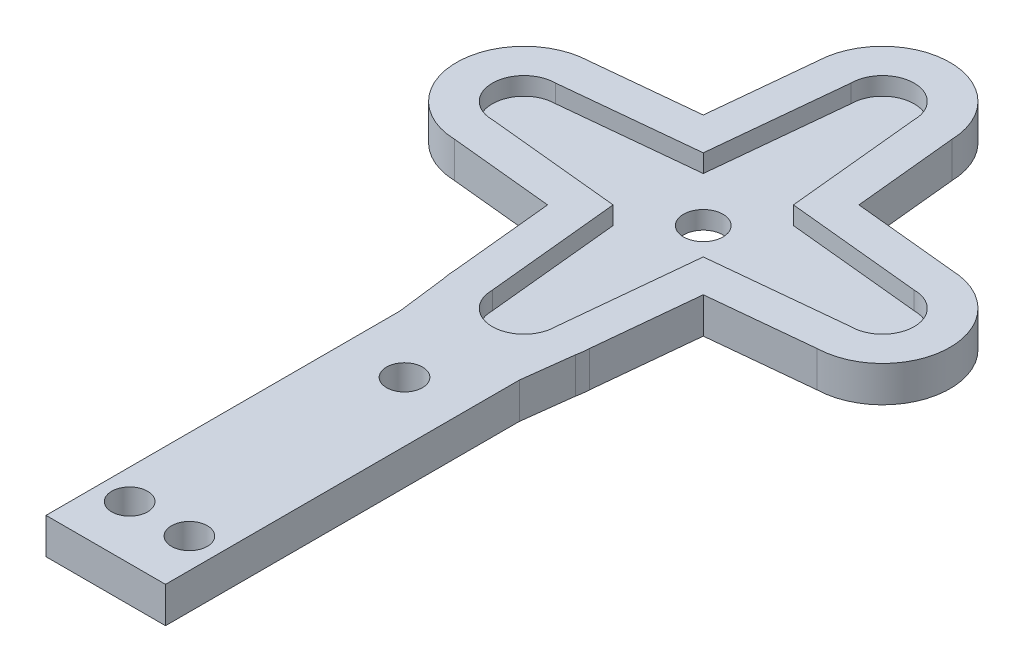
from build123d import *
from build123d.topology import SkipClean

# Parameters (mm, degrees)
SKETCH1_R               = 21
BOSS_EXTRUDE1_DEPTH     = 1.5
SKETCH2_R               = 2.65
CUT_EXTRUDE1_DEPTH      = 1.5
SKETCH5_W               = 10
SKETCH5_H               = 50
BOSS_EXTRUDE2_DEPTH     = 1.5
CIRPATTERN1_DEPTH       = 1.5
CUT_EXTRUDE4_REACH      = 56.252
SKETCH4_R               = 1.65
CUT_EXTRUDE5_REACH      = 56.314
SKETCH6_R               = 1.5
CUT_EXTRUDE6_DEPTH      = 55.251728083
CUT_EXTRUDE6_DEPTH_BACK = 55.251728083
CUT_EXTRUDE8_REACH      = 56.18
SKETCH9_R               = 1.5


# Read off the part's stored shape, not the designer's step: CirPattern1
with BuildPart() as part:
    # Sketch1 → Boss-Extrude1 (new, symmetric)
    with BuildSketch(Plane(origin=(0, 0, 0), x_dir=(1, 0, 0), z_dir=(0, 1, 0))):
        with Locations(Location((0, 0, 0), (0, 0, 270))):
            Circle(SKETCH1_R)
    extrude(amount=BOSS_EXTRUDE1_DEPTH, both=True)

    # Sketch2 → Cut-Extrude1 (cut)
    with BuildSketch(Plane(origin=(0, 1.5, 0), x_dir=(1, 0, 0), z_dir=(0, 1, 0))):
        with Locations((0, -15)):
            Circle(SKETCH2_R)
        with BuildLine():
            ThreePointArc((-2.65, -15), (0, -12.35), (2.65, -15))
            Line((2.65, -15), (4.067821782, -0.821782178))
            ThreePointArc((4.067821782, -0.821782178), (0, -4.15), (-4.067821782, -0.821782178))
            Line((-4.067821782, -0.821782178), (-2.65, -15))
        make_face()
        with BuildLine():
            ThreePointArc((-4.067821782, -0.821782178), (0, -4.15), (4.067821782, -0.821782178))
            Line((4.067821782, -0.821782178), (4.15, 0))
            ThreePointArc((4.15, 0), (0, 4.15), (-4.15, 0))
            Line((-4.15, 0), (-4.067821782, -0.821782178))
        make_face()
    cut_extrude1 = extrude(amount=-CUT_EXTRUDE1_DEPTH, mode=Mode.SUBTRACT)

    # Sketch5 → Boss-Extrude2 (add, symmetric)
    with BuildSketch(Plane(origin=(0, 0, 0), x_dir=(1, 0, 0), z_dir=(0, 1, 0))):
        with Locations((0, -25)):
            Rectangle(SKETCH5_W, SKETCH5_H)
    extrude(amount=BOSS_EXTRUDE2_DEPTH, both=True)

    # Mirror1: Cut-Extrude1 across plane
    with SkipClean():  # the faces are left unmerged after this step: merging them gives an invalid solid
        add(cut_extrude1.mirror(Plane.XY), mode=Mode.SUBTRACT)

    # CirPattern1 outline → CirPattern1 (cut)
    with BuildSketch(Plane(origin=(0, 0, 0), x_dir=(1, 0, 0), z_dir=(0, 1, 0))):
        with BuildLine():
            Line((3.772727273, -3.772727273), (15, -2.65))
            ThreePointArc((15, -2.65), (17.65, 0), (15, 2.65))
            Line((15, 2.65), (3.772727273, 3.772727273))
            Line((3.772727273, 3.772727273), (4.067821782, 0.821782178))
            ThreePointArc((4.067821782, 0.821782178), (0, -4.15), (-4.067821782, 0.821782178))
            Line((-4.067821782, 0.821782178), (-3.772727273, 3.772727273))
            Line((-3.772727273, 3.772727273), (-15, 2.65))
            ThreePointArc((-15, 2.65), (-17.65, 0), (-15, -2.65))
            Line((-15, -2.65), (-3.772727273, -3.772727273))
            Line((-3.772727273, -3.772727273), (-2.65, -15))
            ThreePointArc((-2.65, -15), (0, -17.65), (2.65, -15))
            Line((2.65, -15), (3.772727273, -3.772727273))
        make_face()
    extrude(amount=CIRPATTERN1_DEPTH, mode=Mode.SUBTRACT)

    # Sketch4 → Cut-Extrude4 (cut, up to next)
    with BuildSketch(Plane(origin=(0, 0, 0), x_dir=(1, 0, 0), z_dir=(0, 1, 0)), mode=Mode.PRIVATE) as cut_extrude4_sk1:
        with Locations(Location((0, 0, 0), (0, 0, 270))):
            Circle(SKETCH4_R)
    cut_extrude4_tool1 = extrude(cut_extrude4_sk1.sketch, amount=-CUT_EXTRUDE4_REACH, mode=Mode.PRIVATE) & part.part
    add(cut_extrude4_tool1.solids().sort_by_distance((0, 0, 0))[0], mode=Mode.SUBTRACT)

    # Sketch6 → Cut-Extrude5 (cut, up to next)
    with BuildSketch(Plane(origin=(0, 1.5, 0), x_dir=(1, 0, 0), z_dir=(0, 1, 0)), mode=Mode.PRIVATE) as cut_extrude5_sk1:
        with Locations(Location((2.5, -45.5, 0), (0, 0, 270))):
            Circle(SKETCH6_R)
    cut_extrude5_tool1 = extrude(cut_extrude5_sk1.sketch, amount=-CUT_EXTRUDE5_REACH, mode=Mode.PRIVATE) & part.part
    # Sketch6 → Cut-Extrude5 (cut, up to next)
    with BuildSketch(Plane(origin=(0, 1.5, 0), x_dir=(1, 0, 0), z_dir=(0, 1, 0)), mode=Mode.PRIVATE) as cut_extrude5_sk2:
        with Locations(Location((-2.5, -45.5, 0), (0, 0, 270))):
            Circle(SKETCH6_R)
    cut_extrude5_tool2 = extrude(cut_extrude5_sk2.sketch, amount=-CUT_EXTRUDE5_REACH, mode=Mode.PRIVATE) & part.part
    add(cut_extrude5_tool1.solids().sort_by_distance((2.5, 1.5, 45.5))[0], mode=Mode.SUBTRACT)
    add(cut_extrude5_tool2.solids().sort_by_distance((-2.5, 1.5, 45.5))[0], mode=Mode.SUBTRACT)

    # Sketch7 → Cut-Extrude6 (cut, two sides: drawn at the far end of the back side and taken through both)
    with BuildSketch(Plane(origin=(0, 0, 0), x_dir=(1, 0, 0), z_dir=(0, 1, 0)).offset(-CUT_EXTRUDE6_DEPTH_BACK)):
        with BuildLine():
            ThreePointArc((5, -20.396078054), (0, 21), (-5, -20.396078054))
            Line((-5, -20.396078054), (-5.519486194, -16.207382355))
            ThreePointArc((-5.519486194, -16.207382355), (-5.607043009, -15.695391034), (-5.647210443, -15.177522436))
            Line((-5.647210443, -15.177522436), (-6.513602442, -6.513602442))
            Line((-6.513602442, -6.513602442), (-15.177522436, -5.647210443))
            ThreePointArc((-15.177522436, -5.647210443), (-20.65, 0), (-15.177522436, 5.647210443))
            Line((-15.177522436, 5.647210443), (-6.513602442, 6.513602442))
            Line((-6.513602442, 6.513602442), (-5.647210443, 15.177522436))
            ThreePointArc((-5.647210443, 15.177522436), (0, 20.65), (5.647210443, 15.177522436))
            Line((5.647210443, 15.177522436), (6.513602442, 6.513602442))
            Line((6.513602442, 6.513602442), (15.177522436, 5.647210443))
            ThreePointArc((15.177522436, 5.647210443), (20.65, 0), (15.177522436, -5.647210443))
            Line((15.177522436, -5.647210443), (6.513602442, -6.513602442))
            Line((6.513602442, -6.513602442), (5.647210443, -15.177522436))
            ThreePointArc((5.647210443, -15.177522436), (5.607043009, -15.695391034), (5.519486194, -16.207382355))
            Line((5.519486194, -16.207382355), (5, -20.396078054))
        make_face()
    extrude(amount=CUT_EXTRUDE6_DEPTH + CUT_EXTRUDE6_DEPTH_BACK, mode=Mode.SUBTRACT)

    # Sketch9 → Cut-Extrude8 (cut, up to next)
    with BuildSketch(Plane(origin=(0, 1.5, 0), x_dir=(1, 0, 0), z_dir=(0, 1, 0)), mode=Mode.PRIVATE) as cut_extrude8_sk1:
        with Locations(Location((0, -25, 0), (0, 0, 270))):
            Circle(SKETCH9_R)
    cut_extrude8_tool1 = extrude(cut_extrude8_sk1.sketch, amount=-CUT_EXTRUDE8_REACH, mode=Mode.PRIVATE) & part.part
    add(cut_extrude8_tool1.solids().sort_by_distance((0, 1.5, 25))[0], mode=Mode.SUBTRACT)


solid = part.part
